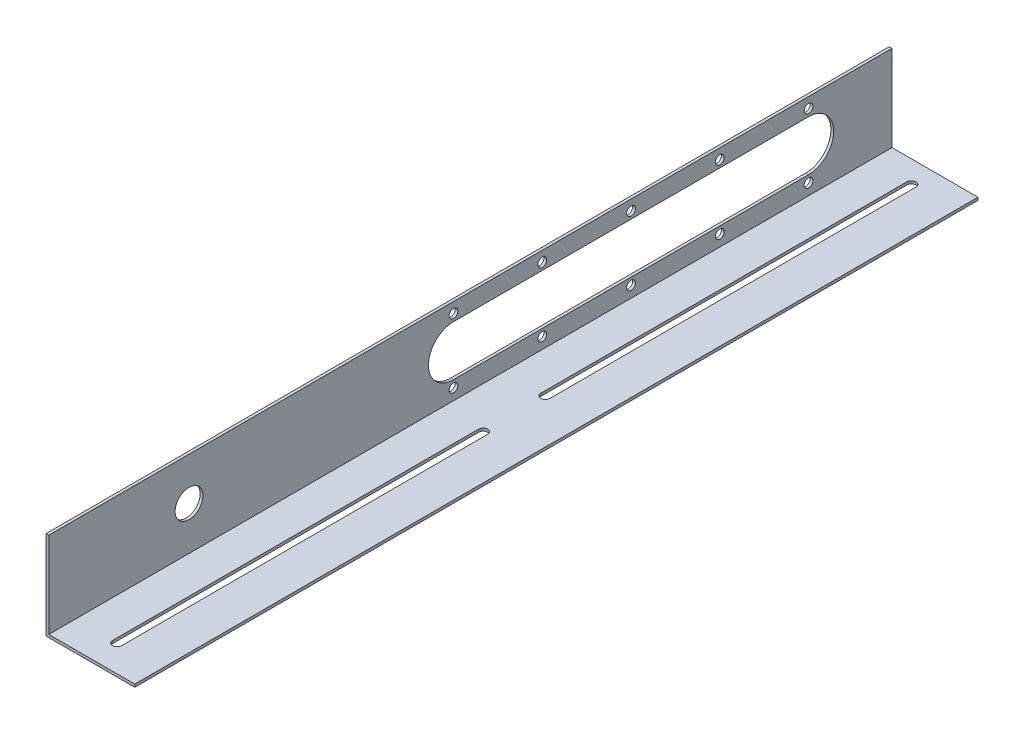
from build123d import *

# Parameters (mm, degrees)
BOSS_EXTRUDE2_DEPTH          = 431.8
CUT_EXTRUDE3_DEPTH           = 127
SKETCH7_R                    = 7.9629
CUT_EXTRUDE4_DEPTH           = 438.372816156
F_10_0_1935_DIAMETER_HOLE1_D = 4.999999906
BOSS_EXTRUDE3_DEPTH          = 50.8
CUT_EXTRUDE5_DEPTH           = 488.755338419


with BuildPart() as part:
    # Sketch3 → Boss-Extrude2 (new body)
    with BuildSketch(Plane.XY):
        Polygon((0, 0), (0, 49.2125), (-1.5875, 49.2125), (-1.5875, -1.5875), (49.2125, -1.5875), (49.2125, 0), align=None)
    extrude(amount=BOSS_EXTRUDE2_DEPTH)

    # Sketch6 → Cut-Extrude3 (cut)
    with BuildSketch(Plane(origin=(0, 0, 0), x_dir=(0, 0, -1), z_dir=(1, 0, 0))):
        with BuildLine():
            Line((-250.952, 39.1795), (-47.752, 39.1795))
            ThreePointArc((-47.752, 39.1795), (-33.401, 24.8285), (-47.752, 10.4775))
            Line((-47.752, 10.4775), (-250.952, 10.4775))
            ThreePointArc((-250.952, 10.4775), (-265.303, 24.8285), (-250.952, 39.1795))
        make_face()
    extrude(amount=-CUT_EXTRUDE3_DEPTH, mode=Mode.SUBTRACT)

    # Sketch7 → Cut-Extrude4 (cut, through all)
    with BuildSketch(Plane(origin=(0, 0, 0), x_dir=(0, 0, -1), z_dir=(1, 0, 0))):
        with Locations((-402.336, 24.773594829)):
            Circle(SKETCH7_R)
    extrude(amount=-CUT_EXTRUDE4_DEPTH, mode=Mode.SUBTRACT)

    # #10 (0.1935) Diameter Hole1 (through all)
    with Locations(Plane(origin=(0, 0, 0), x_dir=(0, 0, -1), z_dir=(1, 0, 0))):
        with Locations((-250.952, 43.2435), (-200.152, 43.2435), (-149.352, 43.2435), (-98.552, 43.2435), (-47.752, 43.2435), (-47.752, 6.4135), (-98.552, 6.4135), (-149.352, 6.4135), (-200.152, 6.4135), (-250.952, 6.4135)):
            Hole(F_10_0_1935_DIAMETER_HOLE1_D / 2)

    # Sketch13 → Boss-Extrude3 (add)
    with BuildSketch(Plane.XY.offset(431.8)):
        Polygon((49.2125, -1.5875), (49.2125, 0), (0, 0), (0, 49.2125), (-1.5875, 49.2125), (-1.5875, -1.5875), align=None)
    extrude(amount=BOSS_EXTRUDE3_DEPTH)

    # Sketch14 → Cut-Extrude5 (cut, through all)
    with BuildSketch(Plane.XZ.offset(1.5875)):
        with BuildLine():
            Line((21.2328125, 12.7), (21.2328125, 222.25))
            ThreePointArc((21.2328125, 222.25), (23.8125, 224.8296875), (26.3921875, 222.25))
            Line((26.3921875, 222.25), (26.3921875, 12.7))
            ThreePointArc((26.3921875, 12.7), (23.8125, 10.1203125), (21.2328125, 12.7))
        make_face()
        with BuildLine():
            Line((21.2328125, 257.7703125), (21.2328125, 467.3203125))
            ThreePointArc((21.2328125, 467.3203125), (23.8125, 469.9), (26.3921875, 467.3203125))
            Line((26.3921875, 467.3203125), (26.3921875, 257.7703125))
            ThreePointArc((26.3921875, 257.7703125), (23.8125, 255.190625), (21.2328125, 257.7703125))
        make_face()
    extrude(amount=-CUT_EXTRUDE5_DEPTH, mode=Mode.SUBTRACT)


solid = part.part
